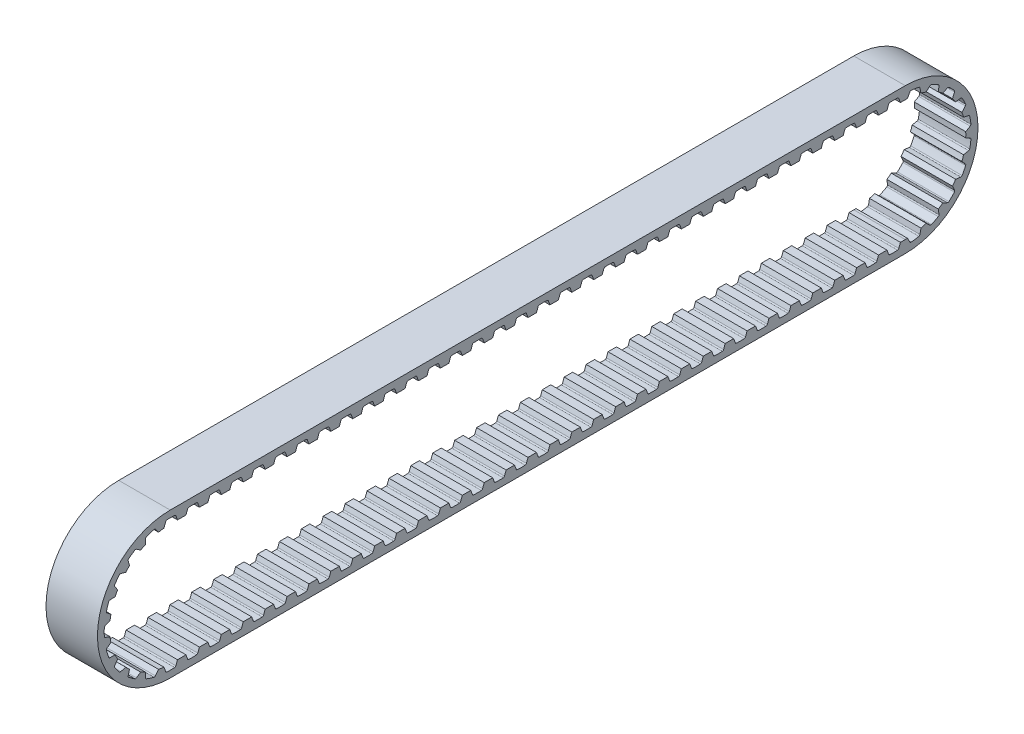
from build123d import *

# Parameters (mm, degrees)
SKETCH_2_W            = 4.8
SKETCH_2_H            = 1.14
CUT_EXTRUDE_1_DEPTH   = 76.708941031
PATTERN_START         = -2.4
PATTERN_CURVE_1_DEPTH = 4.8


# Read off the part's stored shape, not the designer's step: 曲线阵列1
with BuildPart() as part:
    # 扫描1: sweep along a path in 草图1
    with BuildLine(Plane(origin=(0, 0, 0), x_dir=(0, 0, -1), z_dir=(1, 0, 0))) as sweep_1_path:
        Line((0, 6.786), (68.58, 6.786))
        ThreePointArc((68.58, 6.786), (75.366, 0), (68.58, -6.786))
        Line((68.58, -6.786), (0, -6.786))
        ThreePointArc((0, -6.786), (-6.786, 0), (0, 6.786))
    # 草图2 → 扫描1 (sweep)
    with BuildSketch(Plane.XY):
        with Locations((0, 6.216)):
            Rectangle(SKETCH_2_W, SKETCH_2_H)
    sweep(path=sweep_1_path.line)

    # 草图3 → 切除-拉伸1 (cut, symmetric)
    with BuildSketch(Plane(origin=(0, 0, 0), x_dir=(0, 0, -1), z_dir=(1, 0, 0))):
        with BuildLine():
            Line((-6.060123368, 0.475008102), (-4.372, 1.08943476))
            Line((-4.372, 1.08943476), (-4.372, -1.08943476))
            Line((-4.372, -1.08943476), (-6.060123368, -0.475008102))
            ThreePointArc((-6.060123368, -0.475008102), (-6.119920842, -0.430500061), (-6.145437698, -0.360460117))
            ThreePointArc((-6.145437698, -0.360460117), (-6.156, 0), (-6.145437698, 0.360460117))
            ThreePointArc((-6.145437698, 0.360460117), (-6.119920842, 0.430500061), (-6.060123368, 0.475008102))
        make_face()
    extrude(amount=CUT_EXTRUDE_1_DEPTH, both=True, mode=Mode.SUBTRACT)

    # 曲线阵列1 outline → 曲线阵列1 (cut)
    with BuildSketch(Plane.YZ.offset(PATTERN_START)):
        with BuildLine():
            ThreePointArc((2.334167093, 5.612699164), (2.310438245, 5.683364895), (2.251791063, 5.729378065))
            ThreePointArc((2.251791063, 5.729378065), (1.912447921, 5.851399743), (1.566542124, 5.953342068))
            ThreePointArc((1.566542124, 5.953342068), (1.492040602, 5.950846684), (1.431157903, 5.907835051))
            Line((1.431157903, 5.907835051), (1.135418602, 5.530654627))
            ThreePointArc((1.135418602, 5.530654627), (1.754009253, 5.366634657), (2.350064548, 5.133664639))
            Line((2.350064548, 5.133664639), (2.334167093, 5.612699164))
        make_face()
        with BuildLine():
            Line((-2.334167093, 5.612699164), (-2.350064548, 5.133664639))
            ThreePointArc((-2.350064548, 5.133664639), (-1.754009253, 5.366634657), (-1.135418602, 5.530654627))
            Line((-1.135418602, 5.530654627), (-1.431157903, 5.907835051))
            ThreePointArc((-1.431157903, 5.907835051), (-1.492040602, 5.950846684), (-1.566542124, 5.953342068))
            ThreePointArc((-1.566542124, 5.953342068), (-1.912447921, 5.851399743), (-2.251791063, 5.729378065))
            ThreePointArc((-2.251791063, 5.729378065), (-2.310438245, 5.683364895), (-2.334167093, 5.612699164))
        make_face()
        with BuildLine():
            Line((-3.962335863, 4.609839741), (-3.828627901, 4.149569182))
            ThreePointArc((-3.828627901, 4.149569182), (-3.334440966, 4.556184747), (-2.797413427, 4.904262852))
            Line((-2.797413427, 4.904262852), (-3.195695881, 5.170904733))
            ThreePointArc((-3.195695881, 5.170904733), (-3.266928259, 5.192874075), (-3.338518655, 5.172101042))
            ThreePointArc((-3.338518655, 5.172101042), (-3.63563914, 4.967742349), (-3.920283759, 4.746336614))
            ThreePointArc((-3.920283759, 4.746336614), (-3.961734427, 4.684380615), (-3.962335863, 4.609839741))
        make_face()
        with BuildLine():
            Line((-5.198390104, 3.150788514), (-4.928308523, 2.754830503))
            ThreePointArc((-4.928308523, 2.754830503), (-4.584894908, 3.294852755), (-4.182574968, 3.79254303))
            Line((-4.182574968, 3.79254303), (-4.643986365, 3.92225937))
            ThreePointArc((-4.643986365, 3.92225937), (-4.718519234, 3.921012325), (-4.780113886, 3.879026583))
            ThreePointArc((-4.780113886, 3.879026583), (-4.999045883, 3.592474949), (-5.200823419, 3.293595568))
            ThreePointArc((-5.200823419, 3.293595568), (-5.220975597, 3.221827934), (-5.198390104, 3.150788514))
        make_face()
        with BuildLine():
            Line((-5.920009334, 1.379933845), (-5.540281529, 1.087472565))
            ThreePointArc((-5.540281529, 1.087472565), (-5.381625599, 1.707460662), (-5.153827018, 2.305511454))
            Line((-5.153827018, 2.305511454), (-5.63270588, 2.285465465))
            ThreePointArc((-5.63270588, 2.285465465), (-5.703163434, 2.26112544), (-5.748666909, 2.202081918))
            ThreePointArc((-5.748666909, 2.202081918), (-5.867744809, 1.861694621), (-5.966687266, 1.514918831))
            ThreePointArc((-5.966687266, 1.514918831), (-5.963546685, 1.440441718), (-5.920009334, 1.379933845))
        make_face()
        with BuildLine():
            Line((-6.060123368, -0.531048335), (-5.646, -0.681776914))
            Line((-5.646, -0.681776914), (-5.646, 0))
            ThreePointArc((-5.646, 0), (-5.638512279, 0.290680726), (-5.616068975, 0.58059045))
            Line((-5.616068975, 0.58059045), (-6.060123368, 0.418967869))
            ThreePointArc((-6.060123368, 0.418967869), (-6.119920842, 0.374459828), (-6.145437698, 0.304419884))
            ThreePointArc((-6.145437698, 0.304419884), (-6.156, -0.056040233), (-6.145437698, -0.41650035))
            ThreePointArc((-6.145437698, -0.41650035), (-6.119920842, -0.486540294), (-6.060123368, -0.531048335))
        make_face()
        with BuildLine():
            Line((-6.060123368, -2.574866829), (-5.646, -2.725595408))
            Line((-5.646, -2.725595408), (-5.646, -1.474122046))
            Line((-5.646, -1.474122046), (-6.060123368, -1.624850625))
            ThreePointArc((-6.060123368, -1.624850625), (-6.119920842, -1.669358666), (-6.145437698, -1.73939861))
            ThreePointArc((-6.145437698, -1.73939861), (-6.156, -2.099858727), (-6.145437698, -2.460318844))
            ThreePointArc((-6.145437698, -2.460318844), (-6.119920842, -2.530358788), (-6.060123368, -2.574866829))
        make_face()
        with BuildLine():
            Line((-6.060123368, -4.618685322), (-5.646, -4.769413902))
            Line((-5.646, -4.769413902), (-5.646, -3.517940539))
            Line((-5.646, -3.517940539), (-6.060123368, -3.668669118))
            ThreePointArc((-6.060123368, -3.668669118), (-6.119920842, -3.71317716), (-6.145437698, -3.783217103))
            ThreePointArc((-6.145437698, -3.783217103), (-6.156, -4.14367722), (-6.145437698, -4.504137338))
            ThreePointArc((-6.145437698, -4.504137338), (-6.119920842, -4.574177281), (-6.060123368, -4.618685322))
        make_face()
        with BuildLine():
            Line((-6.060123368, -6.662503816), (-5.646, -6.813232395))
            Line((-5.646, -6.813232395), (-5.646, -5.561759033))
            Line((-5.646, -5.561759033), (-6.060123368, -5.712487612))
            ThreePointArc((-6.060123368, -5.712487612), (-6.119920842, -5.756995653), (-6.145437698, -5.827035597))
            ThreePointArc((-6.145437698, -5.827035597), (-6.156, -6.187495714), (-6.145437698, -6.547955831))
            ThreePointArc((-6.145437698, -6.547955831), (-6.119920842, -6.617995775), (-6.060123368, -6.662503816))
        make_face()
        with BuildLine():
            Line((-6.060123368, -8.70632231), (-5.646, -8.857050889))
            Line((-5.646, -8.857050889), (-5.646, -7.605577526))
            Line((-5.646, -7.605577526), (-6.060123368, -7.756306105))
            ThreePointArc((-6.060123368, -7.756306105), (-6.119920842, -7.800814147), (-6.145437698, -7.87085409))
            ThreePointArc((-6.145437698, -7.87085409), (-6.156, -8.231314207), (-6.145437698, -8.591774325))
            ThreePointArc((-6.145437698, -8.591774325), (-6.119920842, -8.661814268), (-6.060123368, -8.70632231))
        make_face()
        with BuildLine():
            Line((-6.060123368, -10.750140803), (-5.646, -10.900869382))
            Line((-5.646, -10.900869382), (-5.646, -9.64939602))
            Line((-5.646, -9.64939602), (-6.060123368, -9.800124599))
            ThreePointArc((-6.060123368, -9.800124599), (-6.119920842, -9.84463264), (-6.145437698, -9.914672584))
            ThreePointArc((-6.145437698, -9.914672584), (-6.156, -10.275132701), (-6.145437698, -10.635592818))
            ThreePointArc((-6.145437698, -10.635592818), (-6.119920842, -10.705632762), (-6.060123368, -10.750140803))
        make_face()
        with BuildLine():
            Line((-6.060123368, -12.793959297), (-5.646, -12.944687876))
            Line((-5.646, -12.944687876), (-5.646, -11.693214513))
            Line((-5.646, -11.693214513), (-6.060123368, -11.843943092))
            ThreePointArc((-6.060123368, -11.843943092), (-6.119920842, -11.888451134), (-6.145437698, -11.958491077))
            ThreePointArc((-6.145437698, -11.958491077), (-6.156, -12.318951195), (-6.145437698, -12.679411312))
            ThreePointArc((-6.145437698, -12.679411312), (-6.119920842, -12.749451255), (-6.060123368, -12.793959297))
        make_face()
        with BuildLine():
            Line((-6.060123368, -14.83777779), (-5.646, -14.988506369))
            Line((-5.646, -14.988506369), (-5.646, -13.737033007))
            Line((-5.646, -13.737033007), (-6.060123368, -13.887761586))
            ThreePointArc((-6.060123368, -13.887761586), (-6.119920842, -13.932269627), (-6.145437698, -14.002309571))
            ThreePointArc((-6.145437698, -14.002309571), (-6.156, -14.362769688), (-6.145437698, -14.723229805))
            ThreePointArc((-6.145437698, -14.723229805), (-6.119920842, -14.793269749), (-6.060123368, -14.83777779))
        make_face()
        with BuildLine():
            Line((-6.060123368, -16.881596284), (-5.646, -17.032324863))
            Line((-5.646, -17.032324863), (-5.646, -15.7808515))
            Line((-5.646, -15.7808515), (-6.060123368, -15.931580079))
            ThreePointArc((-6.060123368, -15.931580079), (-6.119920842, -15.976088121), (-6.145437698, -16.046128064))
            ThreePointArc((-6.145437698, -16.046128064), (-6.156, -16.406588181), (-6.145437698, -16.767048299))
            ThreePointArc((-6.145437698, -16.767048299), (-6.119920842, -16.837088242), (-6.060123368, -16.881596284))
        make_face()
        with BuildLine():
            Line((-6.060123368, -18.925414777), (-5.646, -19.076143356))
            Line((-5.646, -19.076143356), (-5.646, -17.824669994))
            Line((-5.646, -17.824669994), (-6.060123368, -17.975398573))
            ThreePointArc((-6.060123368, -17.975398573), (-6.119920842, -18.019906614), (-6.145437698, -18.089946558))
            ThreePointArc((-6.145437698, -18.089946558), (-6.156, -18.450406675), (-6.145437698, -18.810866792))
            ThreePointArc((-6.145437698, -18.810866792), (-6.119920842, -18.880906736), (-6.060123368, -18.925414777))
        make_face()
        with BuildLine():
            Line((-6.060123368, -20.969233271), (-5.646, -21.11996185))
            Line((-5.646, -21.11996185), (-5.646, -19.868488487))
            Line((-5.646, -19.868488487), (-6.060123368, -20.019217067))
            ThreePointArc((-6.060123368, -20.019217067), (-6.119920842, -20.063725108), (-6.145437698, -20.133765051))
            ThreePointArc((-6.145437698, -20.133765051), (-6.156, -20.494225169), (-6.145437698, -20.854685286))
            ThreePointArc((-6.145437698, -20.854685286), (-6.119920842, -20.924725229), (-6.060123368, -20.969233271))
        make_face()
        with BuildLine():
            Line((-6.060123368, -23.013051764), (-5.646, -23.163780343))
            Line((-5.646, -23.163780343), (-5.646, -21.912306981))
            Line((-5.646, -21.912306981), (-6.060123368, -22.06303556))
            ThreePointArc((-6.060123368, -22.06303556), (-6.119920842, -22.107543601), (-6.145437698, -22.177583545))
            ThreePointArc((-6.145437698, -22.177583545), (-6.156, -22.538043662), (-6.145437698, -22.898503779))
            ThreePointArc((-6.145437698, -22.898503779), (-6.119920842, -22.968543723), (-6.060123368, -23.013051764))
        make_face()
        with BuildLine():
            Line((-6.060123368, -25.056870258), (-5.646, -25.207598837))
            Line((-5.646, -25.207598837), (-5.646, -23.956125475))
            Line((-5.646, -23.956125475), (-6.060123368, -24.106854054))
            ThreePointArc((-6.060123368, -24.106854054), (-6.119920842, -24.151362095), (-6.145437698, -24.221402039))
            ThreePointArc((-6.145437698, -24.221402039), (-6.156, -24.581862156), (-6.145437698, -24.942322273))
            ThreePointArc((-6.145437698, -24.942322273), (-6.119920842, -25.012362217), (-6.060123368, -25.056870258))
        make_face()
        with BuildLine():
            Line((-6.060123368, -27.100688751), (-5.646, -27.25141733))
            Line((-5.646, -27.25141733), (-5.646, -25.999943968))
            Line((-5.646, -25.999943968), (-6.060123368, -26.150672547))
            ThreePointArc((-6.060123368, -26.150672547), (-6.119920842, -26.195180588), (-6.145437698, -26.265220532))
            ThreePointArc((-6.145437698, -26.265220532), (-6.156, -26.625680649), (-6.145437698, -26.986140766))
            ThreePointArc((-6.145437698, -26.986140766), (-6.119920842, -27.05618071), (-6.060123368, -27.100688751))
        make_face()
        with BuildLine():
            Line((-6.060123368, -29.144507245), (-5.646, -29.295235824))
            Line((-5.646, -29.295235824), (-5.646, -28.043762462))
            Line((-5.646, -28.043762462), (-6.060123368, -28.194491041))
            ThreePointArc((-6.060123368, -28.194491041), (-6.119920842, -28.238999082), (-6.145437698, -28.309039026))
            ThreePointArc((-6.145437698, -28.309039026), (-6.156, -28.669499143), (-6.145437698, -29.02995926))
            ThreePointArc((-6.145437698, -29.02995926), (-6.119920842, -29.099999204), (-6.060123368, -29.144507245))
        make_face()
        with BuildLine():
            Line((-6.060123368, -31.188325738), (-5.646, -31.339054318))
            Line((-5.646, -31.339054318), (-5.646, -30.087580955))
            Line((-5.646, -30.087580955), (-6.060123368, -30.238309534))
            ThreePointArc((-6.060123368, -30.238309534), (-6.119920842, -30.282817575), (-6.145437698, -30.352857519))
            ThreePointArc((-6.145437698, -30.352857519), (-6.156, -30.713317636), (-6.145437698, -31.073777753))
            ThreePointArc((-6.145437698, -31.073777753), (-6.119920842, -31.143817697), (-6.060123368, -31.188325738))
        make_face()
        with BuildLine():
            Line((-6.060123368, -33.232144232), (-5.646, -33.382872811))
            Line((-5.646, -33.382872811), (-5.646, -32.131399449))
            Line((-5.646, -32.131399449), (-6.060123368, -32.282128028))
            ThreePointArc((-6.060123368, -32.282128028), (-6.119920842, -32.326636069), (-6.145437698, -32.396676013))
            ThreePointArc((-6.145437698, -32.396676013), (-6.156, -32.75713613), (-6.145437698, -33.117596247))
            ThreePointArc((-6.145437698, -33.117596247), (-6.119920842, -33.187636191), (-6.060123368, -33.232144232))
        make_face()
        with BuildLine():
            Line((-6.060123368, -35.275962725), (-5.646, -35.426691305))
            Line((-5.646, -35.426691305), (-5.646, -34.175217942))
            Line((-5.646, -34.175217942), (-6.060123368, -34.325946521))
            ThreePointArc((-6.060123368, -34.325946521), (-6.119920842, -34.370454563), (-6.145437698, -34.440494506))
            ThreePointArc((-6.145437698, -34.440494506), (-6.156, -34.800954624), (-6.145437698, -35.161414741))
            ThreePointArc((-6.145437698, -35.161414741), (-6.119920842, -35.231454684), (-6.060123368, -35.275962725))
        make_face()
        with BuildLine():
            Line((-6.060123368, -37.319781219), (-5.646, -37.470509798))
            Line((-5.646, -37.470509798), (-5.646, -36.219036436))
            Line((-5.646, -36.219036436), (-6.060123368, -36.369765015))
            ThreePointArc((-6.060123368, -36.369765015), (-6.119920842, -36.414273056), (-6.145437698, -36.484313))
            ThreePointArc((-6.145437698, -36.484313), (-6.156, -36.844773117), (-6.145437698, -37.205233234))
            ThreePointArc((-6.145437698, -37.205233234), (-6.119920842, -37.275273178), (-6.060123368, -37.319781219))
        make_face()
        with BuildLine():
            Line((-6.060123368, -39.363599713), (-5.646, -39.514328292))
            Line((-5.646, -39.514328292), (-5.646, -38.262854929))
            Line((-5.646, -38.262854929), (-6.060123368, -38.413583508))
            ThreePointArc((-6.060123368, -38.413583508), (-6.119920842, -38.45809155), (-6.145437698, -38.528131493))
            ThreePointArc((-6.145437698, -38.528131493), (-6.156, -38.888591611), (-6.145437698, -39.249051728))
            ThreePointArc((-6.145437698, -39.249051728), (-6.119920842, -39.319091671), (-6.060123368, -39.363599713))
        make_face()
        with BuildLine():
            Line((-6.060123368, -41.407418206), (-5.646, -41.558146785))
            Line((-5.646, -41.558146785), (-5.646, -40.306673423))
            Line((-5.646, -40.306673423), (-6.060123368, -40.457402002))
            ThreePointArc((-6.060123368, -40.457402002), (-6.119920842, -40.501910043), (-6.145437698, -40.571949987))
            ThreePointArc((-6.145437698, -40.571949987), (-6.156, -40.932410104), (-6.145437698, -41.292870221))
            ThreePointArc((-6.145437698, -41.292870221), (-6.119920842, -41.362910165), (-6.060123368, -41.407418206))
        make_face()
        with BuildLine():
            Line((-6.060123368, -43.4512367), (-5.646, -43.601965279))
            Line((-5.646, -43.601965279), (-5.646, -42.350491916))
            Line((-5.646, -42.350491916), (-6.060123368, -42.501220495))
            ThreePointArc((-6.060123368, -42.501220495), (-6.119920842, -42.545728537), (-6.145437698, -42.61576848))
            ThreePointArc((-6.145437698, -42.61576848), (-6.156, -42.976228597), (-6.145437698, -43.336688715))
            ThreePointArc((-6.145437698, -43.336688715), (-6.119920842, -43.406728658), (-6.060123368, -43.4512367))
        make_face()
        with BuildLine():
            Line((-6.060123368, -45.495055193), (-5.646, -45.645783772))
            Line((-5.646, -45.645783772), (-5.646, -44.39431041))
            Line((-5.646, -44.39431041), (-6.060123368, -44.545038989))
            ThreePointArc((-6.060123368, -44.545038989), (-6.119920842, -44.58954703), (-6.145437698, -44.659586974))
            ThreePointArc((-6.145437698, -44.659586974), (-6.156, -45.020047091), (-6.145437698, -45.380507208))
            ThreePointArc((-6.145437698, -45.380507208), (-6.119920842, -45.450547152), (-6.060123368, -45.495055193))
        make_face()
        with BuildLine():
            Line((-6.060123368, -47.538873687), (-5.646, -47.689602266))
            Line((-5.646, -47.689602266), (-5.646, -46.438128903))
            Line((-5.646, -46.438128903), (-6.060123368, -46.588857482))
            ThreePointArc((-6.060123368, -46.588857482), (-6.119920842, -46.633365524), (-6.145437698, -46.703405467))
            ThreePointArc((-6.145437698, -46.703405467), (-6.156, -47.063865585), (-6.145437698, -47.424325702))
            ThreePointArc((-6.145437698, -47.424325702), (-6.119920842, -47.494365645), (-6.060123368, -47.538873687))
        make_face()
        with BuildLine():
            Line((-6.060123368, -49.58269218), (-5.646, -49.733420759))
            Line((-5.646, -49.733420759), (-5.646, -48.481947397))
            Line((-5.646, -48.481947397), (-6.060123368, -48.632675976))
            ThreePointArc((-6.060123368, -48.632675976), (-6.119920842, -48.677184017), (-6.145437698, -48.747223961))
            ThreePointArc((-6.145437698, -48.747223961), (-6.156, -49.107684078), (-6.145437698, -49.468144195))
            ThreePointArc((-6.145437698, -49.468144195), (-6.119920842, -49.538184139), (-6.060123368, -49.58269218))
        make_face()
        with BuildLine():
            Line((-6.060123368, -51.626510674), (-5.646, -51.777239253))
            Line((-5.646, -51.777239253), (-5.646, -50.52576589))
            Line((-5.646, -50.52576589), (-6.060123368, -50.67649447))
            ThreePointArc((-6.060123368, -50.67649447), (-6.119920842, -50.721002511), (-6.145437698, -50.791042455))
            ThreePointArc((-6.145437698, -50.791042455), (-6.156, -51.151502572), (-6.145437698, -51.511962689))
            ThreePointArc((-6.145437698, -51.511962689), (-6.119920842, -51.582002632), (-6.060123368, -51.626510674))
        make_face()
        with BuildLine():
            Line((-6.060123368, -53.670329167), (-5.646, -53.821057746))
            Line((-5.646, -53.821057746), (-5.646, -52.569584384))
            Line((-5.646, -52.569584384), (-6.060123368, -52.720312963))
            ThreePointArc((-6.060123368, -52.720312963), (-6.119920842, -52.764821004), (-6.145437698, -52.834860948))
            ThreePointArc((-6.145437698, -52.834860948), (-6.156, -53.195321065), (-6.145437698, -53.555781182))
            ThreePointArc((-6.145437698, -53.555781182), (-6.119920842, -53.625821126), (-6.060123368, -53.670329167))
        make_face()
        with BuildLine():
            Line((-6.060123368, -55.714147661), (-5.646, -55.86487624))
            Line((-5.646, -55.86487624), (-5.646, -54.613402878))
            Line((-5.646, -54.613402878), (-6.060123368, -54.764131457))
            ThreePointArc((-6.060123368, -54.764131457), (-6.119920842, -54.808639498), (-6.145437698, -54.878679442))
            ThreePointArc((-6.145437698, -54.878679442), (-6.156, -55.239139559), (-6.145437698, -55.599599676))
            ThreePointArc((-6.145437698, -55.599599676), (-6.119920842, -55.66963962), (-6.060123368, -55.714147661))
        make_face()
        with BuildLine():
            Line((-6.060123368, -57.757966154), (-5.646, -57.908694733))
            Line((-5.646, -57.908694733), (-5.646, -56.657221371))
            Line((-5.646, -56.657221371), (-6.060123368, -56.80794995))
            ThreePointArc((-6.060123368, -56.80794995), (-6.119920842, -56.852457991), (-6.145437698, -56.922497935))
            ThreePointArc((-6.145437698, -56.922497935), (-6.156, -57.282958052), (-6.145437698, -57.643418169))
            ThreePointArc((-6.145437698, -57.643418169), (-6.119920842, -57.713458113), (-6.060123368, -57.757966154))
        make_face()
        with BuildLine():
            Line((-6.060123368, -59.801784648), (-5.646, -59.952513227))
            Line((-5.646, -59.952513227), (-5.646, -58.701039865))
            Line((-5.646, -58.701039865), (-6.060123368, -58.851768444))
            ThreePointArc((-6.060123368, -58.851768444), (-6.119920842, -58.896276485), (-6.145437698, -58.966316429))
            ThreePointArc((-6.145437698, -58.966316429), (-6.156, -59.326776546), (-6.145437698, -59.687236663))
            ThreePointArc((-6.145437698, -59.687236663), (-6.119920842, -59.757276607), (-6.060123368, -59.801784648))
        make_face()
        with BuildLine():
            Line((-6.060123368, -61.845603141), (-5.646, -61.996331721))
            Line((-5.646, -61.996331721), (-5.646, -60.744858358))
            Line((-5.646, -60.744858358), (-6.060123368, -60.895586937))
            ThreePointArc((-6.060123368, -60.895586937), (-6.119920842, -60.940094979), (-6.145437698, -61.010134922))
            ThreePointArc((-6.145437698, -61.010134922), (-6.156, -61.370595039), (-6.145437698, -61.731055156))
            ThreePointArc((-6.145437698, -61.731055156), (-6.119920842, -61.8010951), (-6.060123368, -61.845603141))
        make_face()
        with BuildLine():
            Line((-6.060123368, -63.889421635), (-5.646, -64.040150214))
            Line((-5.646, -64.040150214), (-5.646, -62.788676852))
            Line((-5.646, -62.788676852), (-6.060123368, -62.939405431))
            ThreePointArc((-6.060123368, -62.939405431), (-6.119920842, -62.983913472), (-6.145437698, -63.053953416))
            ThreePointArc((-6.145437698, -63.053953416), (-6.156, -63.414413533), (-6.145437698, -63.77487365))
            ThreePointArc((-6.145437698, -63.77487365), (-6.119920842, -63.844913594), (-6.060123368, -63.889421635))
        make_face()
        with BuildLine():
            Line((-6.060123368, -65.933240128), (-5.646, -66.083968708))
            Line((-5.646, -66.083968708), (-5.646, -64.832495345))
            Line((-5.646, -64.832495345), (-6.060123368, -64.983223924))
            ThreePointArc((-6.060123368, -64.983223924), (-6.119920842, -65.027731966), (-6.145437698, -65.097771909))
            ThreePointArc((-6.145437698, -65.097771909), (-6.156, -65.458232026), (-6.145437698, -65.818692144))
            ThreePointArc((-6.145437698, -65.818692144), (-6.119920842, -65.888732087), (-6.060123368, -65.933240128))
        make_face()
        with BuildLine():
            Line((-6.060123368, -67.977058622), (-5.646, -68.127787201))
            Line((-5.646, -68.127787201), (-5.646, -66.876313839))
            Line((-5.646, -66.876313839), (-6.060123368, -67.027042418))
            ThreePointArc((-6.060123368, -67.027042418), (-6.119920842, -67.071550459), (-6.145437698, -67.141590403))
            ThreePointArc((-6.145437698, -67.141590403), (-6.156, -67.50205052), (-6.145437698, -67.862510637))
            ThreePointArc((-6.145437698, -67.862510637), (-6.119920842, -67.932550581), (-6.060123368, -67.977058622))
        make_face()
        with BuildLine():
            Line((-5.922073254, -69.951049342), (-5.452308281, -70.046168616))
            ThreePointArc((-5.452308281, -70.046168616), (-5.583203985, -69.419731661), (-5.642367177, -68.782505907))
            Line((-5.642367177, -68.782505907), (-6.063369514, -69.011599421))
            ThreePointArc((-6.063369514, -69.011599421), (-6.115882211, -69.064506135), (-6.130698197, -69.137562211))
            ThreePointArc((-6.130698197, -69.137562211), (-6.087531656, -69.495584148), (-6.023475465, -69.850464216))
            ThreePointArc((-6.023475465, -69.850464216), (-5.987825346, -69.915930029), (-5.922073254, -69.951049342))
        make_face()
        with BuildLine():
            Line((-5.203111997, -71.722984804), (-4.72704096, -71.667458463))
            ThreePointArc((-4.72704096, -71.667458463), (-5.04607136, -71.112682339), (-5.30027028, -70.525366535))
            Line((-5.30027028, -70.525366535), (-5.629270208, -70.873914744))
            ThreePointArc((-5.629270208, -70.873914744), (-5.662748351, -70.940517429), (-5.654135341, -71.014561468))
            ThreePointArc((-5.654135341, -71.014561468), (-5.501880144, -71.341458108), (-5.330744986, -71.658878674))
            ThreePointArc((-5.330744986, -71.658878674), (-5.276520968, -71.710030014), (-5.203111997, -71.722984804))
        make_face()
        with BuildLine():
            Line((-3.969248448, -73.183889083), (-3.533983551, -72.983212039))
            ThreePointArc((-3.533983551, -72.983212039), (-4.009577256, -72.554997639), (-4.433656265, -72.07571282))
            Line((-4.433656265, -72.07571282), (-4.638095803, -72.509223237))
            ThreePointArc((-4.638095803, -72.509223237), (-4.64922638, -72.582930862), (-4.618036723, -72.650635433))
            ThreePointArc((-4.618036723, -72.650635433), (-4.371760111, -72.914056937), (-4.110481599, -73.162605921))
            ThreePointArc((-4.110481599, -73.162605921), (-4.043049715, -73.194380827), (-3.969248448, -73.183889083))
        make_face()
        with BuildLine():
            Line((-2.342586297, -74.189190438), (-1.991201549, -73.863221781))
            ThreePointArc((-1.991201549, -73.863221781), (-2.576293592, -73.603945395), (-3.128285642, -73.280121801))
            Line((-3.128285642, -73.280121801), (-3.187933362, -73.755694041))
            ThreePointArc((-3.187933362, -73.755694041), (-3.175614886, -73.829212466), (-3.124935123, -73.883877494))
            ThreePointArc((-3.124935123, -73.883877494), (-2.809008741, -74.057755553), (-2.483443113, -74.212836435))
            ThreePointArc((-2.483443113, -74.212836435), (-2.409476453, -74.222090449), (-2.342586297, -74.189190438))
        make_face()
        with BuildLine():
            Line((-0.484100757, -74.639403798), (-0.25136935, -74.220401533))
            ThreePointArc((-0.25136935, -74.220401533), (-0.888058762, -74.155721266), (-1.513338473, -74.019404624))
            Line((-1.513338473, -74.019404624), (-1.42229161, -74.489975846))
            ThreePointArc((-1.42229161, -74.489975846), (-1.387743122, -74.556029655), (-1.322588546, -74.592245466))
            ThreePointArc((-1.322588546, -74.592245466), (-0.968276609, -74.659373028), (-0.610641985, -74.705638935))
            ThreePointArc((-0.610641985, -74.705638935), (-0.537460322, -74.691456276), (-0.484100757, -74.639403798))
        make_face()
        with BuildLine():
            Line((1.42229161, -74.489975846), (1.513338473, -74.019404624))
            ThreePointArc((1.513338473, -74.019404624), (0.888058762, -74.155721266), (0.25136935, -74.220401533))
            Line((0.25136935, -74.220401533), (0.484100757, -74.639403798))
            ThreePointArc((0.484100757, -74.639403798), (0.537460322, -74.691456276), (0.610641985, -74.705638935))
            ThreePointArc((0.610641985, -74.705638935), (0.968276609, -74.659373028), (1.322588546, -74.592245466))
            ThreePointArc((1.322588546, -74.592245466), (1.387743122, -74.556029655), (1.42229161, -74.489975846))
        make_face()
        with BuildLine():
            Line((3.187933362, -73.755694041), (3.128285642, -73.280121801))
            ThreePointArc((3.128285642, -73.280121801), (2.576293592, -73.603945395), (1.991201549, -73.863221781))
            Line((1.991201549, -73.863221781), (2.342586297, -74.189190438))
            ThreePointArc((2.342586297, -74.189190438), (2.409476453, -74.222090449), (2.483443113, -74.212836435))
            ThreePointArc((2.483443113, -74.212836435), (2.809008741, -74.057755553), (3.124935123, -73.883877494))
            ThreePointArc((3.124935123, -73.883877494), (3.175614886, -73.829212466), (3.187933362, -73.755694041))
        make_face()
        with BuildLine():
            Line((4.638095803, -72.509223237), (4.433656265, -72.07571282))
            ThreePointArc((4.433656265, -72.07571282), (4.009577256, -72.554997639), (3.533983551, -72.983212039))
            Line((3.533983551, -72.983212039), (3.969248448, -73.183889083))
            ThreePointArc((3.969248448, -73.183889083), (4.043049715, -73.194380827), (4.110481599, -73.162605921))
            ThreePointArc((4.110481599, -73.162605921), (4.371760111, -72.914056937), (4.618036723, -72.650635433))
            ThreePointArc((4.618036723, -72.650635433), (4.64922638, -72.582930862), (4.638095803, -72.509223237))
        make_face()
        with BuildLine():
            Line((5.629270208, -70.873914744), (5.30027028, -70.525366535))
            ThreePointArc((5.30027028, -70.525366535), (5.04607136, -71.112682339), (4.72704096, -71.667458463))
            Line((4.72704096, -71.667458463), (5.203111997, -71.722984804))
            ThreePointArc((5.203111997, -71.722984804), (5.276520968, -71.710030014), (5.330744986, -71.658878674))
            ThreePointArc((5.330744986, -71.658878674), (5.501880144, -71.341458108), (5.654135341, -71.014561468))
            ThreePointArc((5.654135341, -71.014561468), (5.662748351, -70.940517429), (5.629270208, -70.873914744))
        make_face()
        with BuildLine():
            Line((6.063369514, -69.011599421), (5.642367177, -68.782505907))
            ThreePointArc((5.642367177, -68.782505907), (5.583203985, -69.419731661), (5.452308281, -70.046168616))
            Line((5.452308281, -70.046168616), (5.922073254, -69.951049342))
            ThreePointArc((5.922073254, -69.951049342), (5.987825346, -69.915930029), (6.023475465, -69.850464216))
            ThreePointArc((6.023475465, -69.850464216), (6.087531656, -69.495584148), (6.130698197, -69.137562211))
            ThreePointArc((6.130698197, -69.137562211), (6.115882211, -69.064506135), (6.063369514, -69.011599421))
        make_face()
        with BuildLine():
            Line((6.060123368, -67.027042418), (5.646, -66.876313839))
            Line((5.646, -66.876313839), (5.646, -68.127787201))
            Line((5.646, -68.127787201), (6.060123368, -67.977058622))
            ThreePointArc((6.060123368, -67.977058622), (6.119920842, -67.932550581), (6.145437698, -67.862510637))
            ThreePointArc((6.145437698, -67.862510637), (6.156, -67.50205052), (6.145437698, -67.141590403))
            ThreePointArc((6.145437698, -67.141590403), (6.119920842, -67.071550459), (6.060123368, -67.027042418))
        make_face()
        with BuildLine():
            Line((6.060123368, -64.983223924), (5.646, -64.832495345))
            Line((5.646, -64.832495345), (5.646, -66.083968708))
            Line((5.646, -66.083968708), (6.060123368, -65.933240128))
            ThreePointArc((6.060123368, -65.933240128), (6.119920842, -65.888732087), (6.145437698, -65.818692144))
            ThreePointArc((6.145437698, -65.818692144), (6.156, -65.458232026), (6.145437698, -65.097771909))
            ThreePointArc((6.145437698, -65.097771909), (6.119920842, -65.027731966), (6.060123368, -64.983223924))
        make_face()
        with BuildLine():
            Line((6.060123368, -62.939405431), (5.646, -62.788676852))
            Line((5.646, -62.788676852), (5.646, -64.040150214))
            Line((5.646, -64.040150214), (6.060123368, -63.889421635))
            ThreePointArc((6.060123368, -63.889421635), (6.119920842, -63.844913594), (6.145437698, -63.77487365))
            ThreePointArc((6.145437698, -63.77487365), (6.156, -63.414413533), (6.145437698, -63.053953416))
            ThreePointArc((6.145437698, -63.053953416), (6.119920842, -62.983913472), (6.060123368, -62.939405431))
        make_face()
        with BuildLine():
            Line((6.060123368, -60.895586937), (5.646, -60.744858358))
            Line((5.646, -60.744858358), (5.646, -61.996331721))
            Line((5.646, -61.996331721), (6.060123368, -61.845603141))
            ThreePointArc((6.060123368, -61.845603141), (6.119920842, -61.8010951), (6.145437698, -61.731055156))
            ThreePointArc((6.145437698, -61.731055156), (6.156, -61.370595039), (6.145437698, -61.010134922))
            ThreePointArc((6.145437698, -61.010134922), (6.119920842, -60.940094979), (6.060123368, -60.895586937))
        make_face()
        with BuildLine():
            Line((6.060123368, -58.851768444), (5.646, -58.701039865))
            Line((5.646, -58.701039865), (5.646, -59.952513227))
            Line((5.646, -59.952513227), (6.060123368, -59.801784648))
            ThreePointArc((6.060123368, -59.801784648), (6.119920842, -59.757276607), (6.145437698, -59.687236663))
            ThreePointArc((6.145437698, -59.687236663), (6.156, -59.326776546), (6.145437698, -58.966316429))
            ThreePointArc((6.145437698, -58.966316429), (6.119920842, -58.896276485), (6.060123368, -58.851768444))
        make_face()
        with BuildLine():
            Line((6.060123368, -56.80794995), (5.646, -56.657221371))
            Line((5.646, -56.657221371), (5.646, -57.908694733))
            Line((5.646, -57.908694733), (6.060123368, -57.757966154))
            ThreePointArc((6.060123368, -57.757966154), (6.119920842, -57.713458113), (6.145437698, -57.643418169))
            ThreePointArc((6.145437698, -57.643418169), (6.156, -57.282958052), (6.145437698, -56.922497935))
            ThreePointArc((6.145437698, -56.922497935), (6.119920842, -56.852457991), (6.060123368, -56.80794995))
        make_face()
        with BuildLine():
            Line((6.060123368, -54.764131457), (5.646, -54.613402878))
            Line((5.646, -54.613402878), (5.646, -55.86487624))
            Line((5.646, -55.86487624), (6.060123368, -55.714147661))
            ThreePointArc((6.060123368, -55.714147661), (6.119920842, -55.66963962), (6.145437698, -55.599599676))
            ThreePointArc((6.145437698, -55.599599676), (6.156, -55.239139559), (6.145437698, -54.878679442))
            ThreePointArc((6.145437698, -54.878679442), (6.119920842, -54.808639498), (6.060123368, -54.764131457))
        make_face()
        with BuildLine():
            Line((6.060123368, -52.720312963), (5.646, -52.569584384))
            Line((5.646, -52.569584384), (5.646, -53.821057746))
            Line((5.646, -53.821057746), (6.060123368, -53.670329167))
            ThreePointArc((6.060123368, -53.670329167), (6.119920842, -53.625821126), (6.145437698, -53.555781182))
            ThreePointArc((6.145437698, -53.555781182), (6.156, -53.195321065), (6.145437698, -52.834860948))
            ThreePointArc((6.145437698, -52.834860948), (6.119920842, -52.764821004), (6.060123368, -52.720312963))
        make_face()
        with BuildLine():
            Line((6.060123368, -50.67649447), (5.646, -50.52576589))
            Line((5.646, -50.52576589), (5.646, -51.777239253))
            Line((5.646, -51.777239253), (6.060123368, -51.626510674))
            ThreePointArc((6.060123368, -51.626510674), (6.119920842, -51.582002632), (6.145437698, -51.511962689))
            ThreePointArc((6.145437698, -51.511962689), (6.156, -51.151502572), (6.145437698, -50.791042455))
            ThreePointArc((6.145437698, -50.791042455), (6.119920842, -50.721002511), (6.060123368, -50.67649447))
        make_face()
        with BuildLine():
            Line((6.060123368, -48.632675976), (5.646, -48.481947397))
            Line((5.646, -48.481947397), (5.646, -49.733420759))
            Line((5.646, -49.733420759), (6.060123368, -49.58269218))
            ThreePointArc((6.060123368, -49.58269218), (6.119920842, -49.538184139), (6.145437698, -49.468144195))
            ThreePointArc((6.145437698, -49.468144195), (6.156, -49.107684078), (6.145437698, -48.747223961))
            ThreePointArc((6.145437698, -48.747223961), (6.119920842, -48.677184017), (6.060123368, -48.632675976))
        make_face()
        with BuildLine():
            Line((6.060123368, -46.588857482), (5.646, -46.438128903))
            Line((5.646, -46.438128903), (5.646, -47.689602266))
            Line((5.646, -47.689602266), (6.060123368, -47.538873687))
            ThreePointArc((6.060123368, -47.538873687), (6.119920842, -47.494365645), (6.145437698, -47.424325702))
            ThreePointArc((6.145437698, -47.424325702), (6.156, -47.063865585), (6.145437698, -46.703405467))
            ThreePointArc((6.145437698, -46.703405467), (6.119920842, -46.633365524), (6.060123368, -46.588857482))
        make_face()
        with BuildLine():
            Line((6.060123368, -44.545038989), (5.646, -44.39431041))
            Line((5.646, -44.39431041), (5.646, -45.645783772))
            Line((5.646, -45.645783772), (6.060123368, -45.495055193))
            ThreePointArc((6.060123368, -45.495055193), (6.119920842, -45.450547152), (6.145437698, -45.380507208))
            ThreePointArc((6.145437698, -45.380507208), (6.156, -45.020047091), (6.145437698, -44.659586974))
            ThreePointArc((6.145437698, -44.659586974), (6.119920842, -44.58954703), (6.060123368, -44.545038989))
        make_face()
        with BuildLine():
            Line((6.060123368, -42.501220495), (5.646, -42.350491916))
            Line((5.646, -42.350491916), (5.646, -43.601965279))
            Line((5.646, -43.601965279), (6.060123368, -43.4512367))
            ThreePointArc((6.060123368, -43.4512367), (6.119920842, -43.406728658), (6.145437698, -43.336688715))
            ThreePointArc((6.145437698, -43.336688715), (6.156, -42.976228597), (6.145437698, -42.61576848))
            ThreePointArc((6.145437698, -42.61576848), (6.119920842, -42.545728537), (6.060123368, -42.501220495))
        make_face()
        with BuildLine():
            Line((6.060123368, -40.457402002), (5.646, -40.306673423))
            Line((5.646, -40.306673423), (5.646, -41.558146785))
            Line((5.646, -41.558146785), (6.060123368, -41.407418206))
            ThreePointArc((6.060123368, -41.407418206), (6.119920842, -41.362910165), (6.145437698, -41.292870221))
            ThreePointArc((6.145437698, -41.292870221), (6.156, -40.932410104), (6.145437698, -40.571949987))
            ThreePointArc((6.145437698, -40.571949987), (6.119920842, -40.501910043), (6.060123368, -40.457402002))
        make_face()
        with BuildLine():
            Line((6.060123368, -38.413583508), (5.646, -38.262854929))
            Line((5.646, -38.262854929), (5.646, -39.514328292))
            Line((5.646, -39.514328292), (6.060123368, -39.363599713))
            ThreePointArc((6.060123368, -39.363599713), (6.119920842, -39.319091671), (6.145437698, -39.249051728))
            ThreePointArc((6.145437698, -39.249051728), (6.156, -38.888591611), (6.145437698, -38.528131493))
            ThreePointArc((6.145437698, -38.528131493), (6.119920842, -38.45809155), (6.060123368, -38.413583508))
        make_face()
        with BuildLine():
            Line((6.060123368, -36.369765015), (5.646, -36.219036436))
            Line((5.646, -36.219036436), (5.646, -37.470509798))
            Line((5.646, -37.470509798), (6.060123368, -37.319781219))
            ThreePointArc((6.060123368, -37.319781219), (6.119920842, -37.275273178), (6.145437698, -37.205233234))
            ThreePointArc((6.145437698, -37.205233234), (6.156, -36.844773117), (6.145437698, -36.484313))
            ThreePointArc((6.145437698, -36.484313), (6.119920842, -36.414273056), (6.060123368, -36.369765015))
        make_face()
        with BuildLine():
            Line((6.060123368, -34.325946521), (5.646, -34.175217942))
            Line((5.646, -34.175217942), (5.646, -35.426691305))
            Line((5.646, -35.426691305), (6.060123368, -35.275962725))
            ThreePointArc((6.060123368, -35.275962725), (6.119920842, -35.231454684), (6.145437698, -35.161414741))
            ThreePointArc((6.145437698, -35.161414741), (6.156, -34.800954624), (6.145437698, -34.440494506))
            ThreePointArc((6.145437698, -34.440494506), (6.119920842, -34.370454563), (6.060123368, -34.325946521))
        make_face()
        with BuildLine():
            Line((6.060123368, -32.282128028), (5.646, -32.131399449))
            Line((5.646, -32.131399449), (5.646, -33.382872811))
            Line((5.646, -33.382872811), (6.060123368, -33.232144232))
            ThreePointArc((6.060123368, -33.232144232), (6.119920842, -33.187636191), (6.145437698, -33.117596247))
            ThreePointArc((6.145437698, -33.117596247), (6.156, -32.75713613), (6.145437698, -32.396676013))
            ThreePointArc((6.145437698, -32.396676013), (6.119920842, -32.326636069), (6.060123368, -32.282128028))
        make_face()
        with BuildLine():
            Line((6.060123368, -30.238309534), (5.646, -30.087580955))
            Line((5.646, -30.087580955), (5.646, -31.339054318))
            Line((5.646, -31.339054318), (6.060123368, -31.188325738))
            ThreePointArc((6.060123368, -31.188325738), (6.119920842, -31.143817697), (6.145437698, -31.073777753))
            ThreePointArc((6.145437698, -31.073777753), (6.156, -30.713317636), (6.145437698, -30.352857519))
            ThreePointArc((6.145437698, -30.352857519), (6.119920842, -30.282817575), (6.060123368, -30.238309534))
        make_face()
        with BuildLine():
            Line((6.060123368, -28.194491041), (5.646, -28.043762462))
            Line((5.646, -28.043762462), (5.646, -29.295235824))
            Line((5.646, -29.295235824), (6.060123368, -29.144507245))
            ThreePointArc((6.060123368, -29.144507245), (6.119920842, -29.099999204), (6.145437698, -29.02995926))
            ThreePointArc((6.145437698, -29.02995926), (6.156, -28.669499143), (6.145437698, -28.309039026))
            ThreePointArc((6.145437698, -28.309039026), (6.119920842, -28.238999082), (6.060123368, -28.194491041))
        make_face()
        with BuildLine():
            Line((6.060123368, -26.150672547), (5.646, -25.999943968))
            Line((5.646, -25.999943968), (5.646, -27.25141733))
            Line((5.646, -27.25141733), (6.060123368, -27.100688751))
            ThreePointArc((6.060123368, -27.100688751), (6.119920842, -27.05618071), (6.145437698, -26.986140766))
            ThreePointArc((6.145437698, -26.986140766), (6.156, -26.625680649), (6.145437698, -26.265220532))
            ThreePointArc((6.145437698, -26.265220532), (6.119920842, -26.195180588), (6.060123368, -26.150672547))
        make_face()
        with BuildLine():
            Line((6.060123368, -24.106854054), (5.646, -23.956125475))
            Line((5.646, -23.956125475), (5.646, -25.207598837))
            Line((5.646, -25.207598837), (6.060123368, -25.056870258))
            ThreePointArc((6.060123368, -25.056870258), (6.119920842, -25.012362217), (6.145437698, -24.942322273))
            ThreePointArc((6.145437698, -24.942322273), (6.156, -24.581862156), (6.145437698, -24.221402039))
            ThreePointArc((6.145437698, -24.221402039), (6.119920842, -24.151362095), (6.060123368, -24.106854054))
        make_face()
        with BuildLine():
            Line((6.060123368, -22.06303556), (5.646, -21.912306981))
            Line((5.646, -21.912306981), (5.646, -23.163780343))
            Line((5.646, -23.163780343), (6.060123368, -23.013051764))
            ThreePointArc((6.060123368, -23.013051764), (6.119920842, -22.968543723), (6.145437698, -22.898503779))
            ThreePointArc((6.145437698, -22.898503779), (6.156, -22.538043662), (6.145437698, -22.177583545))
            ThreePointArc((6.145437698, -22.177583545), (6.119920842, -22.107543601), (6.060123368, -22.06303556))
        make_face()
        with BuildLine():
            Line((6.060123368, -20.019217067), (5.646, -19.868488487))
            Line((5.646, -19.868488487), (5.646, -21.11996185))
            Line((5.646, -21.11996185), (6.060123368, -20.969233271))
            ThreePointArc((6.060123368, -20.969233271), (6.119920842, -20.924725229), (6.145437698, -20.854685286))
            ThreePointArc((6.145437698, -20.854685286), (6.156, -20.494225168), (6.145437698, -20.133765051))
            ThreePointArc((6.145437698, -20.133765051), (6.119920842, -20.063725108), (6.060123368, -20.019217067))
        make_face()
        with BuildLine():
            Line((6.060123368, -17.975398573), (5.646, -17.824669994))
            Line((5.646, -17.824669994), (5.646, -19.076143356))
            Line((5.646, -19.076143356), (6.060123368, -18.925414777))
            ThreePointArc((6.060123368, -18.925414777), (6.119920842, -18.880906736), (6.145437698, -18.810866792))
            ThreePointArc((6.145437698, -18.810866792), (6.156, -18.450406675), (6.145437698, -18.089946558))
            ThreePointArc((6.145437698, -18.089946558), (6.119920842, -18.019906614), (6.060123368, -17.975398573))
        make_face()
        with BuildLine():
            Line((6.060123368, -15.931580079), (5.646, -15.7808515))
            Line((5.646, -15.7808515), (5.646, -17.032324863))
            Line((5.646, -17.032324863), (6.060123368, -16.881596284))
            ThreePointArc((6.060123368, -16.881596284), (6.119920842, -16.837088242), (6.145437698, -16.767048299))
            ThreePointArc((6.145437698, -16.767048299), (6.156, -16.406588181), (6.145437698, -16.046128064))
            ThreePointArc((6.145437698, -16.046128064), (6.119920842, -15.976088121), (6.060123368, -15.931580079))
        make_face()
        with BuildLine():
            Line((6.060123368, -13.887761586), (5.646, -13.737033007))
            Line((5.646, -13.737033007), (5.646, -14.988506369))
            Line((5.646, -14.988506369), (6.060123368, -14.83777779))
            ThreePointArc((6.060123368, -14.83777779), (6.119920842, -14.793269749), (6.145437698, -14.723229805))
            ThreePointArc((6.145437698, -14.723229805), (6.156, -14.362769688), (6.145437698, -14.002309571))
            ThreePointArc((6.145437698, -14.002309571), (6.119920842, -13.932269627), (6.060123368, -13.887761586))
        make_face()
        with BuildLine():
            Line((6.060123368, -11.843943092), (5.646, -11.693214513))
            Line((5.646, -11.693214513), (5.646, -12.944687876))
            Line((5.646, -12.944687876), (6.060123368, -12.793959297))
            ThreePointArc((6.060123368, -12.793959297), (6.119920842, -12.749451255), (6.145437698, -12.679411312))
            ThreePointArc((6.145437698, -12.679411312), (6.156, -12.318951194), (6.145437698, -11.958491077))
            ThreePointArc((6.145437698, -11.958491077), (6.119920842, -11.888451134), (6.060123368, -11.843943092))
        make_face()
        with BuildLine():
            Line((6.060123368, -9.800124599), (5.646, -9.64939602))
            Line((5.646, -9.64939602), (5.646, -10.900869382))
            Line((5.646, -10.900869382), (6.060123368, -10.750140803))
            ThreePointArc((6.060123368, -10.750140803), (6.119920842, -10.705632762), (6.145437698, -10.635592818))
            ThreePointArc((6.145437698, -10.635592818), (6.156, -10.275132701), (6.145437698, -9.914672584))
            ThreePointArc((6.145437698, -9.914672584), (6.119920842, -9.84463264), (6.060123368, -9.800124599))
        make_face()
        with BuildLine():
            Line((6.060123368, -7.756306105), (5.646, -7.605577526))
            Line((5.646, -7.605577526), (5.646, -8.857050889))
            Line((5.646, -8.857050889), (6.060123368, -8.70632231))
            ThreePointArc((6.060123368, -8.70632231), (6.119920842, -8.661814268), (6.145437698, -8.591774325))
            ThreePointArc((6.145437698, -8.591774325), (6.156, -8.231314207), (6.145437698, -7.87085409))
            ThreePointArc((6.145437698, -7.87085409), (6.119920842, -7.800814147), (6.060123368, -7.756306105))
        make_face()
        with BuildLine():
            Line((6.060123368, -5.712487612), (5.646, -5.561759033))
            Line((5.646, -5.561759033), (5.646, -6.813232395))
            Line((5.646, -6.813232395), (6.060123368, -6.662503816))
            ThreePointArc((6.060123368, -6.662503816), (6.119920842, -6.617995775), (6.145437698, -6.547955831))
            ThreePointArc((6.145437698, -6.547955831), (6.156, -6.187495714), (6.145437698, -5.827035597))
            ThreePointArc((6.145437698, -5.827035597), (6.119920842, -5.756995653), (6.060123368, -5.712487612))
        make_face()
        with BuildLine():
            Line((6.060123368, -3.668669118), (5.646, -3.517940539))
            Line((5.646, -3.517940539), (5.646, -4.769413902))
            Line((5.646, -4.769413902), (6.060123368, -4.618685322))
            ThreePointArc((6.060123368, -4.618685322), (6.119920842, -4.574177281), (6.145437698, -4.504137338))
            ThreePointArc((6.145437698, -4.504137338), (6.156, -4.14367722), (6.145437698, -3.783217103))
            ThreePointArc((6.145437698, -3.783217103), (6.119920842, -3.71317716), (6.060123368, -3.668669118))
        make_face()
        with BuildLine():
            Line((6.060123368, -1.624850625), (5.646, -1.474122046))
            Line((5.646, -1.474122046), (5.646, -2.725595408))
            Line((5.646, -2.725595408), (6.060123368, -2.574866829))
            ThreePointArc((6.060123368, -2.574866829), (6.119920842, -2.530358788), (6.145437698, -2.460318844))
            ThreePointArc((6.145437698, -2.460318844), (6.156, -2.099858727), (6.145437698, -1.73939861))
            ThreePointArc((6.145437698, -1.73939861), (6.119920842, -1.669358666), (6.060123368, -1.624850625))
        make_face()
        with BuildLine():
            Line((6.060123368, 0.418967869), (5.616068975, 0.58059045))
            ThreePointArc((5.616068975, 0.58059045), (5.638512279, 0.290680726), (5.646, 0))
            Line((5.646, 0), (5.646, -0.681776914))
            Line((5.646, -0.681776914), (6.060123368, -0.531048335))
            ThreePointArc((6.060123368, -0.531048335), (6.119920842, -0.486540294), (6.145437698, -0.41650035))
            ThreePointArc((6.145437698, -0.41650035), (6.156, -0.056040233), (6.145437698, 0.304419884))
            ThreePointArc((6.145437698, 0.304419884), (6.119920842, 0.374459828), (6.060123368, 0.418967869))
        make_face()
        with BuildLine():
            Line((5.63270588, 2.285465465), (5.153827018, 2.305511454))
            ThreePointArc((5.153827018, 2.305511454), (5.381625599, 1.707460662), (5.540281529, 1.087472565))
            Line((5.540281529, 1.087472565), (5.920009334, 1.379933845))
            ThreePointArc((5.920009334, 1.379933845), (5.963546685, 1.440441718), (5.966687266, 1.514918831))
            ThreePointArc((5.966687266, 1.514918831), (5.867744809, 1.861694621), (5.748666909, 2.202081918))
            ThreePointArc((5.748666909, 2.202081918), (5.703163434, 2.26112544), (5.63270588, 2.285465465))
        make_face()
        with BuildLine():
            Line((4.643986365, 3.92225937), (4.182574968, 3.79254303))
            ThreePointArc((4.182574968, 3.79254303), (4.584894908, 3.294852755), (4.928308523, 2.754830503))
            Line((4.928308523, 2.754830503), (5.198390104, 3.150788514))
            ThreePointArc((5.198390104, 3.150788514), (5.220975597, 3.221827934), (5.200823419, 3.293595568))
            ThreePointArc((5.200823419, 3.293595568), (4.999045883, 3.592474949), (4.780113886, 3.879026583))
            ThreePointArc((4.780113886, 3.879026583), (4.718519234, 3.921012325), (4.643986365, 3.92225937))
        make_face()
        with BuildLine():
            Line((3.195695881, 5.170904733), (2.797413427, 4.904262852))
            ThreePointArc((2.797413427, 4.904262852), (3.334440966, 4.556184747), (3.828627901, 4.149569182))
            Line((3.828627901, 4.149569182), (3.962335863, 4.609839741))
            ThreePointArc((3.962335863, 4.609839741), (3.961734427, 4.684380615), (3.920283759, 4.746336614))
            ThreePointArc((3.920283759, 4.746336614), (3.63563914, 4.967742349), (3.338518655, 5.172101042))
            ThreePointArc((3.338518655, 5.172101042), (3.266928259, 5.192874075), (3.195695881, 5.170904733))
        make_face()
    extrude(amount=PATTERN_CURVE_1_DEPTH, mode=Mode.SUBTRACT)


solid = part.part
